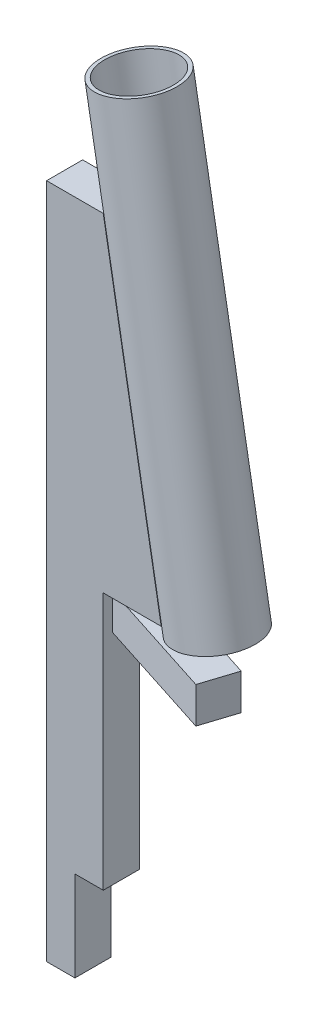
from build123d import *

# Parameters (mm, degrees)
MAIN_EXTRUSION_DEPTH = 14
BOSS_EXTRU_2_DEPTH   = 28
ESQUISSE3_R          = 30
ESQUISSE3_R_2        = 27
BOSS_EXTRU_3_DEPTH   = 350


with BuildPart() as part:
    # Esquisse1 → Main Extrusion (new, symmetric)
    with BuildSketch(Plane.XY):
        Polygon((0, 525.207681883), (0, 0), (22, 0), (22, 70), (44, 70), (44, 270), (89, 270), (44, 525.207681883), align=None)
    extrude(amount=MAIN_EXTRUSION_DEPTH, both=True)

    # Esquisse2 → Boss.-Extru.2 (add)
    with BuildSketch(Plane(origin=(0, 270, 0), x_dir=(-1, 0, 0), z_dir=(0, -1, 0))):
        Polygon((-46.383252389, -9.036050221), (-141.571816076, -39.681398043), (-150.152513466, -13.02860021), (-54.963949779, 17.616747611), align=None)
    extrude(amount=BOSS_EXTRU_2_DEPTH)


with BuildPart() as body_2:
    # Esquisse3 → Boss.-Extru.3 (new body)
    with BuildSketch(Plane(origin=(-43.489040974, 246.638607428, 0), x_dir=(0, 0, -1), z_dir=(0.1736481776669273, -0.9848077530122086, 0))):
        with Locations((0, 164.532897988)):
            Circle(ESQUISSE3_R)
        with Locations((0, 164.532897988)):
            Circle(ESQUISSE3_R_2, mode=Mode.SUBTRACT)
    extrude(amount=-BOSS_EXTRU_3_DEPTH)


solid = Compound([part.part, body_2.part])
